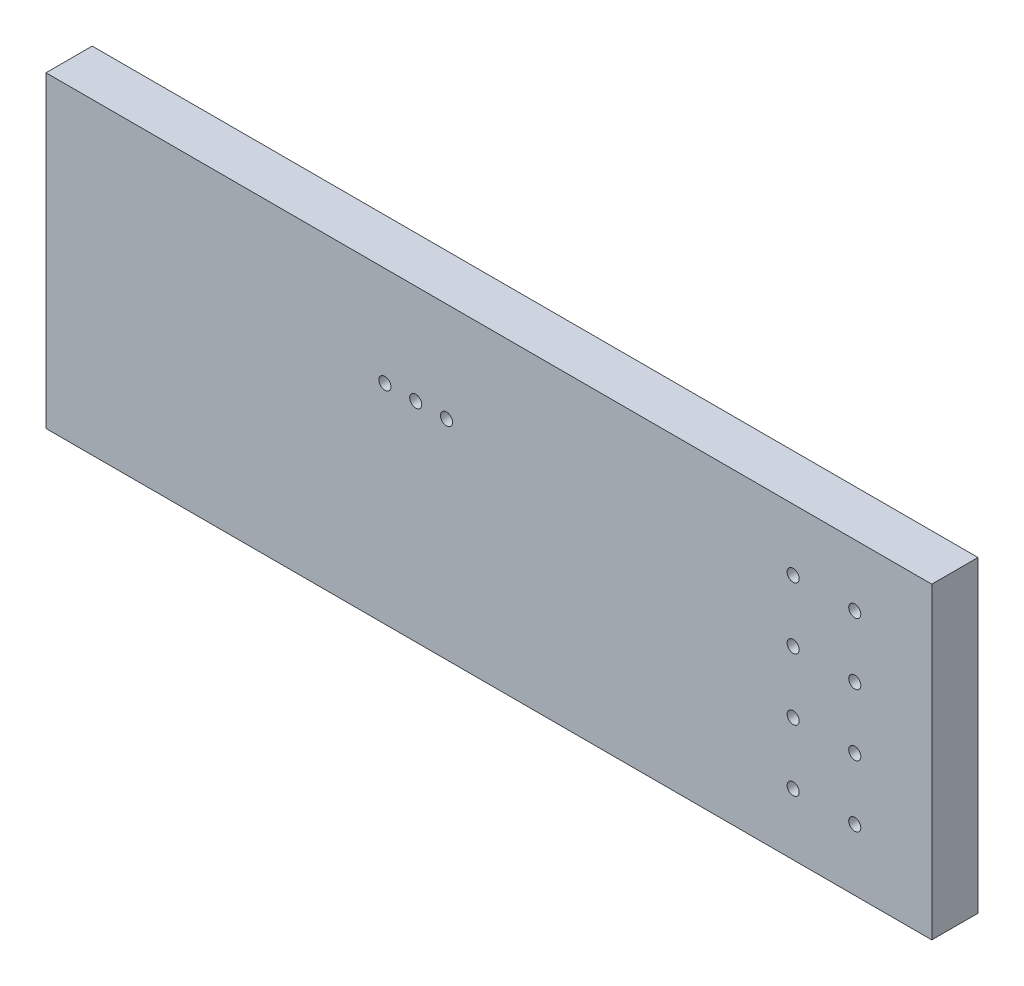
from build123d import *

# Parameters (mm, degrees)
SKETCH1_W           = 717.55
SKETCH1_H           = 127
BOSS_EXTRUDE1_DEPTH = 19.05
SKETCH2_R           = 2.4892
CUT_EXTRUDE1_DEPTH  = 25.4
SKETCH4_R           = 2.4892
CUT_EXTRUDE2_DEPTH  = 729.951236366
SKETCH5_W           = 352.425
SKETCH5_H           = 127
CUT_EXTRUDE3_DEPTH  = 729.951236366


with BuildPart() as part:
    # Sketch1 → Boss-Extrude1 (new body)
    with BuildSketch(Plane.XY):
        with Locations((358.775, 63.5)):
            Rectangle(SKETCH1_W, SKETCH1_H)
    extrude(amount=BOSS_EXTRUDE1_DEPTH)

    # Sketch2 → Cut-Extrude1 (cut)
    with BuildSketch(Plane.XY.offset(19.05)):
        with Locations((12.7, 101.6)):
            Circle(SKETCH2_R)
        with Locations((38.1, 101.6)):
            Circle(SKETCH2_R)
        with Locations((38.1, 76.2)):
            Circle(SKETCH2_R)
        with Locations((38.1, 50.8)):
            Circle(SKETCH2_R)
        with Locations((38.1, 25.4)):
            Circle(SKETCH2_R)
        with Locations((12.7, 76.2)):
            Circle(SKETCH2_R)
        with Locations((12.7, 50.8)):
            Circle(SKETCH2_R)
        with Locations((12.7, 25.4)):
            Circle(SKETCH2_R)
        with Locations((685.8, 101.6)):
            Circle(SKETCH2_R)
        with Locations((660.4, 101.6)):
            Circle(SKETCH2_R)
        with Locations((660.4, 76.2)):
            Circle(SKETCH2_R)
        with Locations((660.4, 50.8)):
            Circle(SKETCH2_R)
        with Locations((660.4, 25.4)):
            Circle(SKETCH2_R)
        with Locations((685.8, 76.2)):
            Circle(SKETCH2_R)
        with Locations((685.8, 50.8)):
            Circle(SKETCH2_R)
        with Locations((685.8, 25.4)):
            Circle(SKETCH2_R)
    extrude(amount=-CUT_EXTRUDE1_DEPTH, mode=Mode.SUBTRACT)

    # Sketch4 → Cut-Extrude2 (cut, through all)
    with BuildSketch(Plane.XY.offset(19.05)):
        with Locations((180.975, 85.979)):
            Circle(SKETCH4_R)
        with Locations((193.675, 85.979)):
            Circle(SKETCH4_R)
        with Locations((206.375, 85.979)):
            Circle(SKETCH4_R)
        with Locations((492.125, 85.979)):
            Circle(SKETCH4_R)
        with Locations((504.825, 85.979)):
            Circle(SKETCH4_R)
        with Locations((517.525, 85.979)):
            Circle(SKETCH4_R)
    extrude(amount=-CUT_EXTRUDE2_DEPTH, mode=Mode.SUBTRACT)

    # Sketch5 → Cut-Extrude3 (cut, through all)
    with BuildSketch(Plane.XY.offset(19.05)):
        with Locations((176.2125, 63.5)):
            Rectangle(SKETCH5_W, SKETCH5_H)
    extrude(amount=-CUT_EXTRUDE3_DEPTH, mode=Mode.SUBTRACT)


solid = part.part
